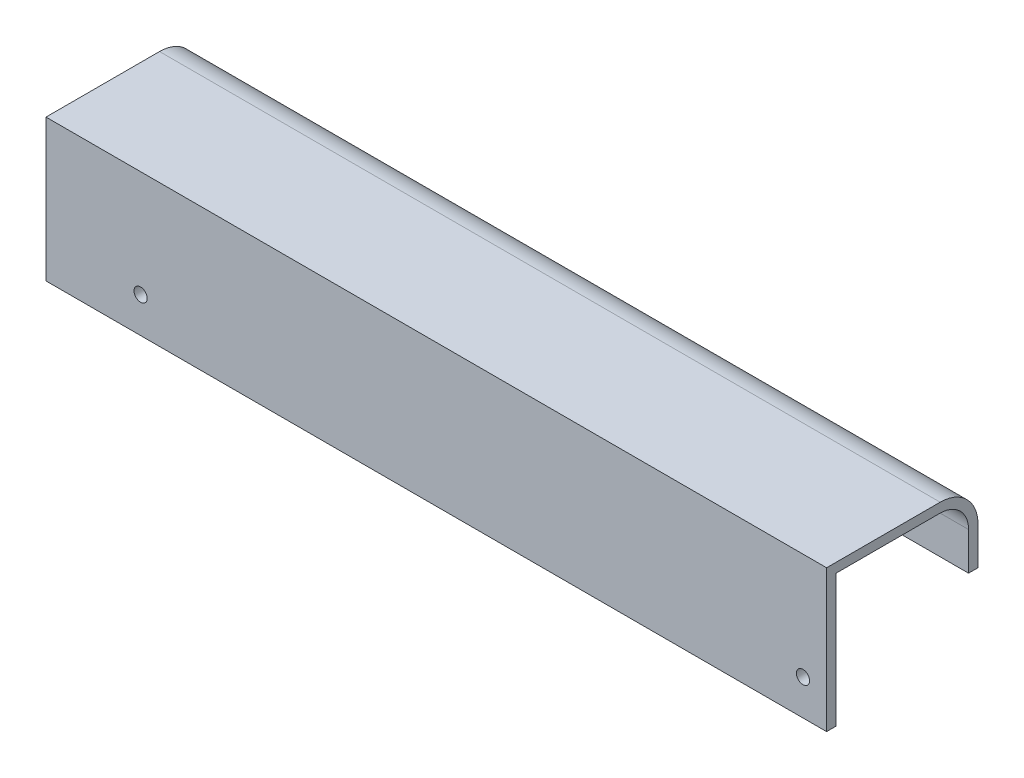
from build123d import *

# Parameters (mm, degrees)
SKETCH1_W           = 209.55
SKETCH1_H           = 38.1
BOSS_EXTRUDE1_DEPTH = 20.32
FILLET1_R           = 10.16
SKETCH2_W           = 209.55
SKETCH2_H           = 38.1
SKETCH2_R           = 1.778
BOSS_EXTRUDE2_DEPTH = 2.54
SHELL5_START        = -190.5
SHELL5_DEPTH        = 207.01
CUT_EXTRUDE1_DEPTH  = 209.55
BOSS_EXTRUDE3_DEPTH = 50.8


# Read off the part's stored shape, not the designer's step: Shell5
with BuildPart() as part:
    # Sketch1 → Boss-Extrude1 (new body)
    with BuildSketch(Plane(origin=(0, 0, 0), x_dir=(1, 0, 0), z_dir=(0, 1, 0))):
        with Locations((-85.725, 19.05)):
            Rectangle(SKETCH1_W, SKETCH1_H)
    extrude(amount=BOSS_EXTRUDE1_DEPTH)

    # Fillet1
    fillet1_edges = [part.edges().sort_by_distance(p)[0] for p in [
        (-85.725, 20.32, -38.1),
    ]]
    fillet(fillet1_edges, radius=FILLET1_R)

    # Sketch2 → Boss-Extrude2 (add)
    with BuildSketch(Plane.XY):
        with Locations((-85.725, 1.27)):
            Rectangle(SKETCH2_W, SKETCH2_H)
        with Locations((-165.1, -8.255)):
            Circle(SKETCH2_R, mode=Mode.SUBTRACT)
        with Locations((12.7, -8.255)):
            Circle(SKETCH2_R, mode=Mode.SUBTRACT)
    extrude(amount=BOSS_EXTRUDE2_DEPTH)

    # Shell5 outline → Shell5 (cut)
    with BuildSketch(Plane.YZ.offset(SHELL5_START)):
        with BuildLine():
            Line((17.78, -27.94), (17.78, 0))
            Line((17.78, 0), (2.54, 0))
            Line((2.54, 0), (2.54, -35.56))
            Line((2.54, -35.56), (10.16, -35.56))
            ThreePointArc((10.16, -35.56), (15.548153673, -33.328153673), (17.78, -27.94))
        make_face()
    extrude(amount=SHELL5_DEPTH, mode=Mode.SUBTRACT)

    # Sketch3 → Cut-Extrude1 (cut)
    with BuildSketch(Plane.ZY.offset(190.5)):
        with BuildLine():
            Line((0, 0), (-35.56, 0))
            Line((-35.56, 0), (-35.56, 2.54))
            Line((-35.56, 2.54), (-35.56, 10.16))
            ThreePointArc((-35.56, 10.16), (-33.328153673, 15.548153673), (-27.94, 17.78))
            Line((-27.94, 17.78), (0, 17.78))
            Line((0, 17.78), (0, 0))
        make_face()
    extrude(amount=-CUT_EXTRUDE1_DEPTH, mode=Mode.SUBTRACT)


with BuildPart() as body_2:
    # Sketch4 → Boss-Extrude3 (new body)
    with BuildSketch(Plane.ZY.offset(190.5)):
        with BuildLine():
            Line((-35.56, 0), (-30.48, 0))
            add(Edge.make_bspline(
                [(-5.08, 0), (-5.08, 12.7), (-17.78, 12.7), (-30.48, 12.7), (-30.48, 0)],
                knots=[3.141592654, 3.141592654, 3.141592654, 4.71238898, 4.71238898, 6.283185307, 6.283185307, 6.283185307], degree=2, weights=[1, 0.707106781, 1, 0.707106781, 1]))
            Line((-5.08, 0), (0, 0))
            Line((0, 0), (0, 17.78))
            Line((0, 17.78), (-27.94, 17.78))
            ThreePointArc((-27.94, 17.78), (-33.328153673, 15.548153673), (-35.56, 10.16))
            Line((-35.56, 10.16), (-35.56, 0))
        make_face()
    extrude(amount=-BOSS_EXTRUDE3_DEPTH)


solid = Compound([part.part, body_2.part])
